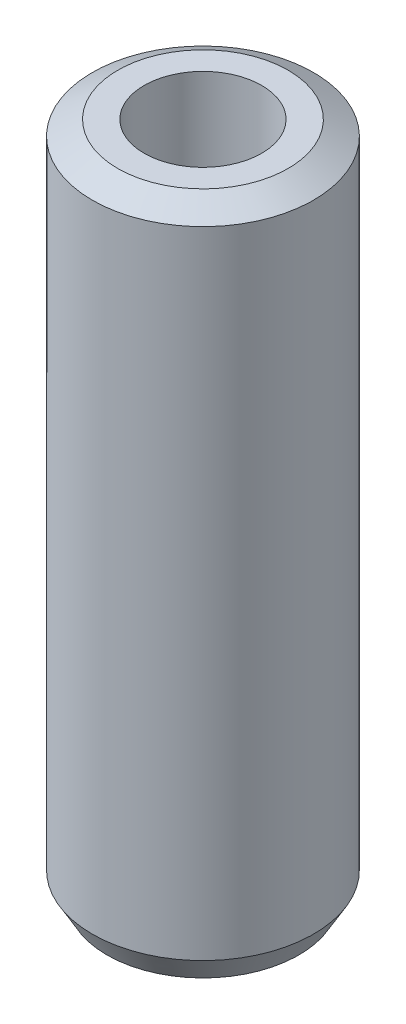
from build123d import *
from OCP.BRepFilletAPI import BRepFilletAPI_MakeChamfer

# Parameters (mm, degrees)
SKETCH1_R           = 30
BOSS_EXTRUDE1_DEPTH = 183.250623489
SKETCH2_R           = 15.946042313
CUT_EXTRUDE1_DEPTH  = 189.097822978
CHAMFER1_SIZE       = 3.984341347
CHAMFER1_SIZE2      = 6.901081648


with BuildPart() as part:
    # Sketch1 → Boss-Extrude1 (new body)
    with BuildSketch(Plane(origin=(0, 0, 0), x_dir=(1, 0, 0), z_dir=(0, 1, 0))):
        Circle(SKETCH1_R)
    extrude(amount=BOSS_EXTRUDE1_DEPTH)

    # Sketch2 → Cut-Extrude1 (cut, through all)
    with BuildSketch(Plane(origin=(0, 0, 0), x_dir=(1, 0, 0), z_dir=(0, 1, 0))):
        Circle(SKETCH2_R)
    extrude(amount=CUT_EXTRUDE1_DEPTH, mode=Mode.SUBTRACT)

    # Chamfer1: one chamfer whose edges measure the first distance from different faces: ONE call of the kernel's chamfer builder (chamfer() names one face for all edges)
    chamfer1_edges_1 = [part.edges().sort_by_distance(p)[0] for p in [
        (-30, 183.250623489, 0),
    ]]
    chamfer1_side_1 = [part.faces().sort_by_distance(p)[0] for p in [
        (-30, 91.625311744, 0),
    ]]
    chamfer1_edges_2 = [part.edges().sort_by_distance(p)[0] for p in [
        (-30, 0, 0),
    ]]
    chamfer1_side_2 = [part.faces().sort_by_distance(p)[0] for p in [
        (-29.151471863, 0, 0),
    ]]
    chamfer1 = BRepFilletAPI_MakeChamfer(part.part.solid().wrapped)
    for e in chamfer1_edges_1:
        chamfer1.Add(CHAMFER1_SIZE, CHAMFER1_SIZE2, e.wrapped, chamfer1_side_1[0].wrapped)  # the first distance lies on this face
    for e in chamfer1_edges_2:
        chamfer1.Add(CHAMFER1_SIZE, CHAMFER1_SIZE2, e.wrapped, chamfer1_side_2[0].wrapped)  # the first distance lies on this face
    add(Compound.cast(chamfer1.Shape()), mode=Mode.REPLACE)


solid = part.part
